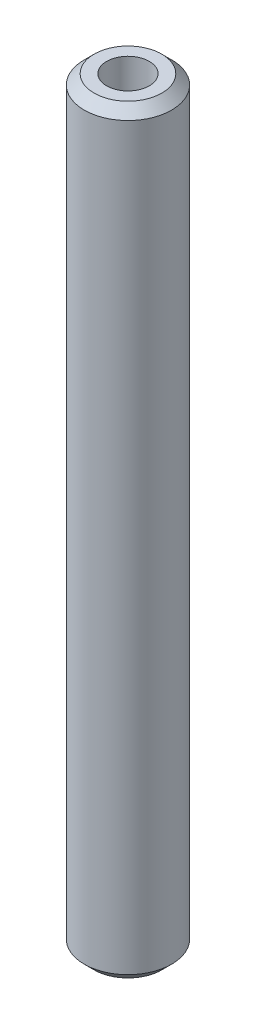
from build123d import *

# Parameters (mm, degrees)
SKETCH1_R           = 17.5
BOSS_EXTRUDE1_DEPTH = 304.529368946
SKETCH2_R           = 8.536330335
CUT_EXTRUDE1_DEPTH  = 306.533364055
CHAMFER1_SIZE       = 3.935690442


with BuildPart() as part:
    # Sketch1 → Boss-Extrude1 (new body)
    with BuildSketch(Plane(origin=(0, 0, 0), x_dir=(1, 0, 0), z_dir=(0, 1, 0))):
        Circle(SKETCH1_R)
    extrude(amount=BOSS_EXTRUDE1_DEPTH)

    # Sketch2 → Cut-Extrude1 (cut, through all)
    with BuildSketch(Plane(origin=(0, 0, 0), x_dir=(1, 0, 0), z_dir=(0, 1, 0))):
        Circle(SKETCH2_R)
    extrude(amount=CUT_EXTRUDE1_DEPTH, mode=Mode.SUBTRACT)

    # Chamfer1
    chamfer1_edges = [part.edges().sort_by_distance(p)[0] for p in [
        (-17.5, 304.529368946, 0),
        (-17.5, 0, 0),
    ]]
    chamfer(chamfer1_edges, length=CHAMFER1_SIZE)


solid = part.part
